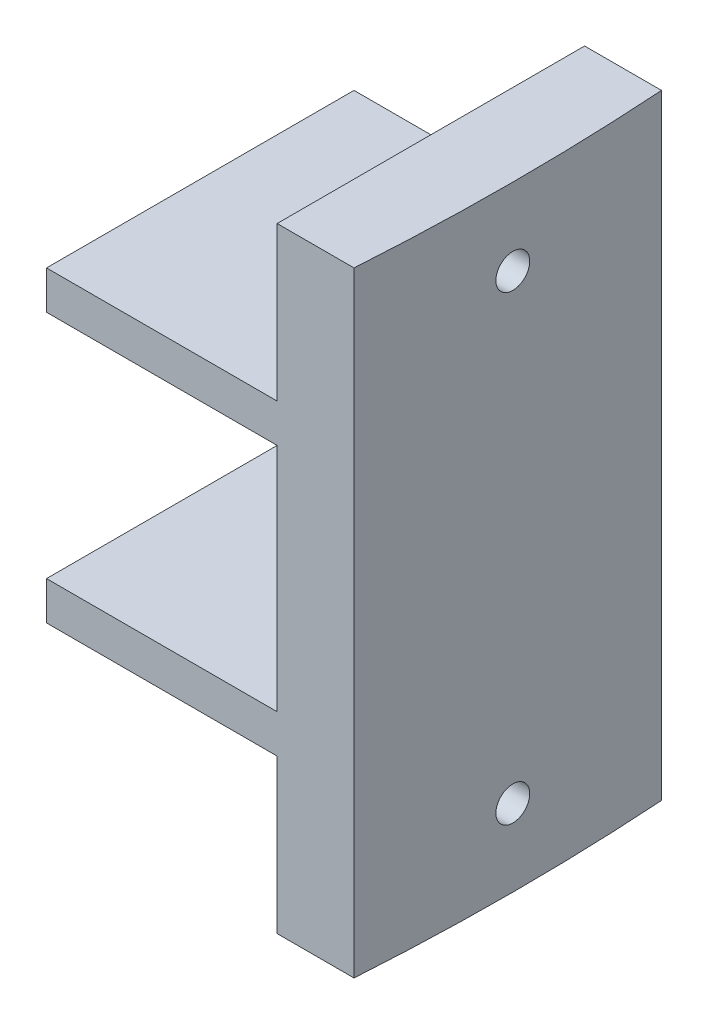
from build123d import *

# Parameters (mm, degrees)
SKETCH1_R                = 1.1303
BOSS_EXTRUDE1_DEPTH      = 12.7
SKETCH2_W                = 9.525
SKETCH2_H                = 9.525
CUT_EXTRUDE1_DEPTH       = 97.928543268
BOSS_EXTRUDE2_DEPTH      = 6.35
BOSS_EXTRUDE2_DEPTH_BACK = 19.05
SKETCH5_R                = 0.6985
CUT_EXTRUDE2_DEPTH       = 23.225


with BuildPart() as part:
    # Sketch1 → Boss-Extrude1 (new body)
    with BuildSketch(Plane(origin=(0, 0, 0), x_dir=(1, 0, 0), z_dir=(0, 1, 0))):
        with BuildLine():
            Line((82.338097624, 6.35), (82.338097624, -6.35))
            Line((82.338097624, -6.35), (95.038097624, -6.35))
            ThreePointArc((95.038097624, -6.35), (95.25, 0), (95.038097624, 6.35))
            Line((95.038097624, 6.35), (82.338097624, 6.35))
        make_face()
        with Locations((88.688097624, 0)):
            Circle(SKETCH1_R, mode=Mode.SUBTRACT)
    extrude(amount=BOSS_EXTRUDE1_DEPTH)

    # Sketch2 → Cut-Extrude1 (cut, through all)
    with BuildSketch(Plane.XY.offset(6.35)):
        with Locations((87.100597624, 6.35)):
            Rectangle(SKETCH2_W, SKETCH2_H)
    extrude(amount=-CUT_EXTRUDE1_DEPTH, mode=Mode.SUBTRACT)

    # Sketch3 → Boss-Extrude2 (add, two sides: drawn at the far end of the back side and taken through both)
    with BuildSketch(Plane(origin=(0, 12.7, 0), x_dir=(1, 0, 0), z_dir=(0, 1, 0)).offset(-BOSS_EXTRUDE2_DEPTH_BACK)):
        with BuildLine():
            Line((91.863097624, -6.35), (95.038097624, -6.35))
            ThreePointArc((95.038097624, -6.35), (95.25, 0), (95.038097624, 6.35))
            Line((95.038097624, 6.35), (91.863097624, 6.35))
            Line((91.863097624, 6.35), (91.863097624, -6.35))
        make_face()
    extrude(amount=BOSS_EXTRUDE2_DEPTH + BOSS_EXTRUDE2_DEPTH_BACK)

    # Sketch5 → Cut-Extrude2 (cut, through all)
    with BuildSketch(Plane.ZY.offset(-91.863097624)):
        with Locations((0, 15.875)):
            Circle(SKETCH5_R)
        with Locations((0, -3.175)):
            Circle(SKETCH5_R)
    extrude(amount=-CUT_EXTRUDE2_DEPTH, mode=Mode.SUBTRACT)


solid = part.part
